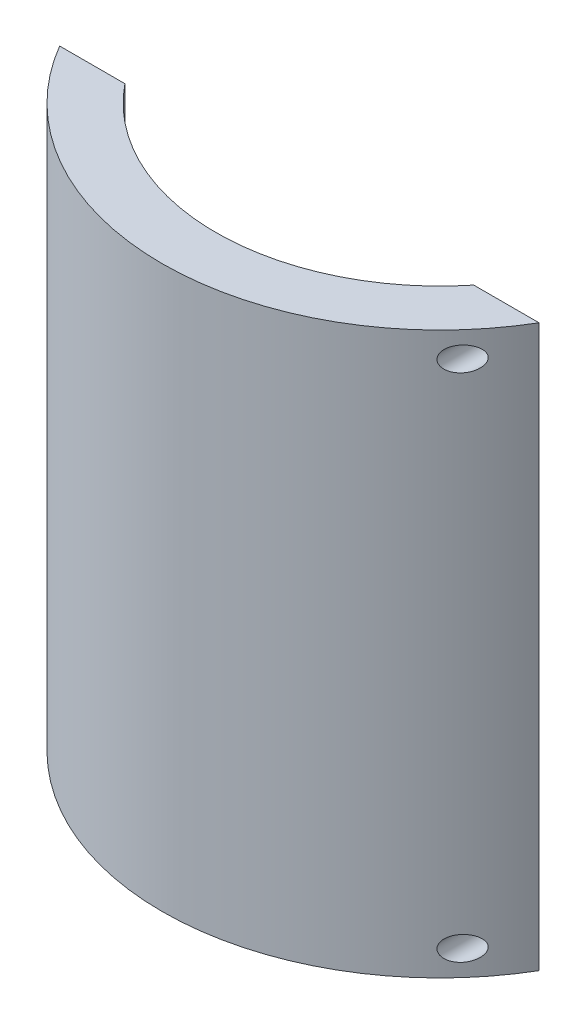
from build123d import *

# Parameters (mm, degrees)
BOSS_EXTRUDE1_DEPTH                        = 100
SKETCH2_R                                  = 2.15
CUT_EXTRUDE1_DEPTH                         = 18
MIRROR1_AT_THE_SECOND_PLANE_COPY_1_SKETC_R = 2.15
MIRROR1_AT_THE_SECOND_PLANE_COPY_1_DEPTH   = 18


with BuildPart() as part:
    # Sketch1 → Boss-Extrude1 (new body)
    with BuildSketch(Plane(origin=(0, 0, 0), x_dir=(1, 0, 0), z_dir=(0, 1, 0))):
        with BuildLine():
            ThreePointArc((31.086694629, -25.07), (0, -39.936042405), (-31.086694629, -25.07))
            Line((-31.086694629, -25.07), (-42.716694629, -25.07))
            ThreePointArc((-42.716694629, -25.07), (0, -49.53), (42.716694629, -25.07))
            Line((42.716694629, -25.07), (31.086694629, -25.07))
        make_face()
    extrude(amount=BOSS_EXTRUDE1_DEPTH)

    # Sketch2 → Cut-Extrude1 (cut)
    with BuildSketch(Plane(origin=(0, 0, 25.07), x_dir=(-1, 0, 0), z_dir=(0, 0, -1))):
        with Locations((-36.901694629, 4.5125)):
            Circle(SKETCH2_R)
    cut_extrude1 = extrude(amount=-CUT_EXTRUDE1_DEPTH, mode=Mode.SUBTRACT)

    # Mirror1: Cut-Extrude1 across plane
    add(cut_extrude1.mirror(Plane(origin=(0, 50, 0), x_dir=(0, 0, 1), z_dir=(0, -1, 0))), mode=Mode.SUBTRACT)

    # Mirror1 at the second plane: Cut-Extrude1 across plane
    add(cut_extrude1.mirror(Plane(origin=(0, 0, 0), x_dir=(0, 0, 1), z_dir=(1, 0, 0))), mode=Mode.SUBTRACT)

    # Mirror1 at the second plane copy 1 sketc → Mirror1 at the second plane copy 1 (cut)
    with BuildSketch(Plane(origin=(0, 100, 25.07), x_dir=(1, 0, 0), z_dir=(0, 0, -1))):
        with Locations((-36.901694629, 4.5125)):
            Circle(MIRROR1_AT_THE_SECOND_PLANE_COPY_1_SKETC_R)
    extrude(amount=-MIRROR1_AT_THE_SECOND_PLANE_COPY_1_DEPTH, mode=Mode.SUBTRACT)


solid = part.part
